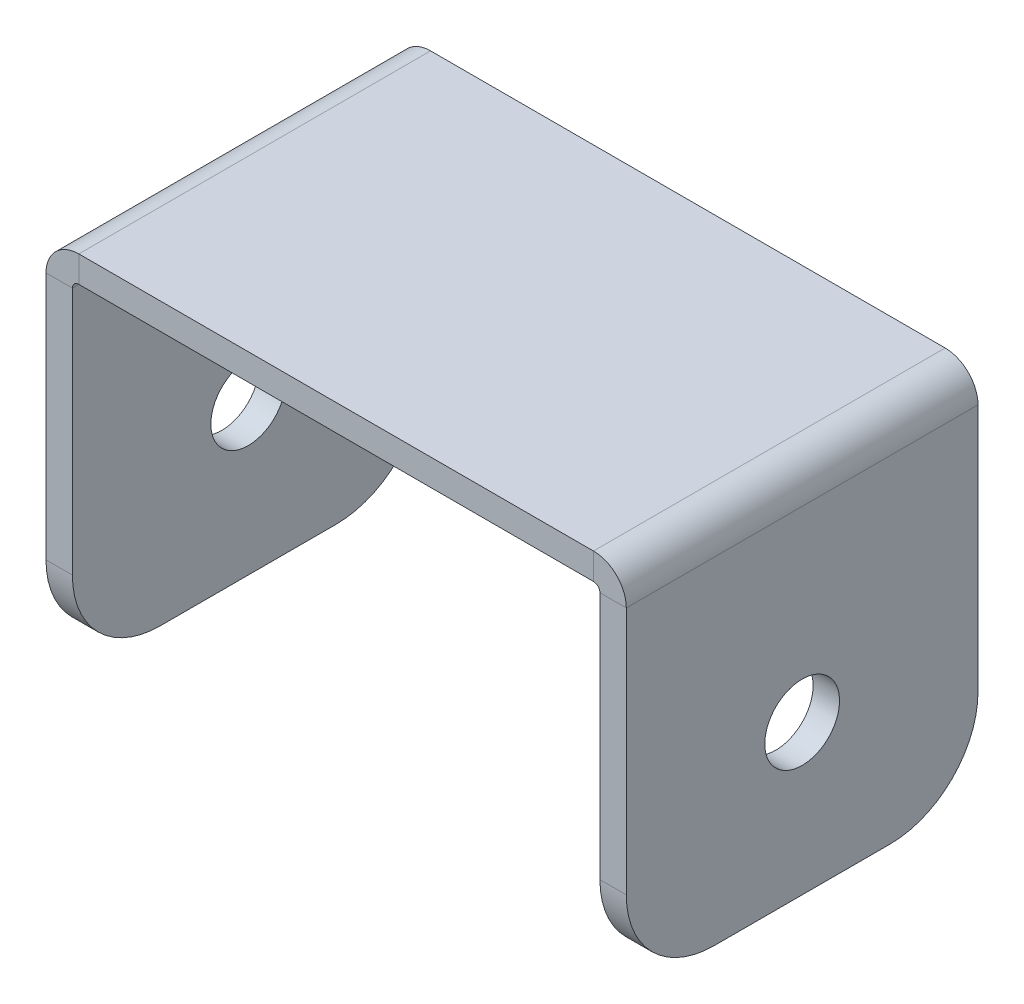
from build123d import *

# Parameters (mm, degrees)
BASE_FLANGE1_DEPTH = 40
FILLET1_R          = 10
SKETCH6_R          = 4.25
CUT_EXTRUDE1_DEPTH = 88.863530546


# Sheet-metal steps are written as plain solids
with BuildPart() as part:
    # Sketch1 → Base-Flange1 (new body)
    with BuildSketch(Plane.XY):
        with BuildLine():
            Line((0, 0), (0, 38.2634))
            ThreePointArc((0, 38.2634), (0.215745145, 38.784254855), (0.7366, 39))
            Line((0.7366, 39), (59.2634, 39))
            ThreePointArc((59.2634, 39), (59.784254855, 38.784254855), (60, 38.2634))
            Line((60, 38.2634), (60, 0))
            Line((60, 0), (63, 0))
            Line((63, 0), (63, 38.2634))
            ThreePointArc((63, 38.2634), (61.905575199, 40.905575199), (59.2634, 42))
            Line((59.2634, 42), (0.7366, 42))
            ThreePointArc((0.7366, 42), (-1.905575199, 40.905575199), (-3, 38.2634))
            Line((-3, 38.2634), (-3, 0))
            Line((-3, 0), (0, 0))
        make_face()
    extrude(amount=-BASE_FLANGE1_DEPTH)

    # Fillet1
    fillet1_edges = [part.edges().sort_by_distance(p)[0] for p in [
        (-1.5, 0, 0),
        (61.5, 0, 0),
        (-1.5, 0, -40),
        (61.5, 0, -40),
    ]]
    fillet(fillet1_edges, radius=FILLET1_R)

    # Sketch6 → Cut-Extrude1 (cut, through all)
    with BuildSketch(Plane.ZY.offset(3)):
        with Locations((-20, 17)):
            Circle(SKETCH6_R)
    extrude(amount=-CUT_EXTRUDE1_DEPTH, mode=Mode.SUBTRACT)


solid = part.part
